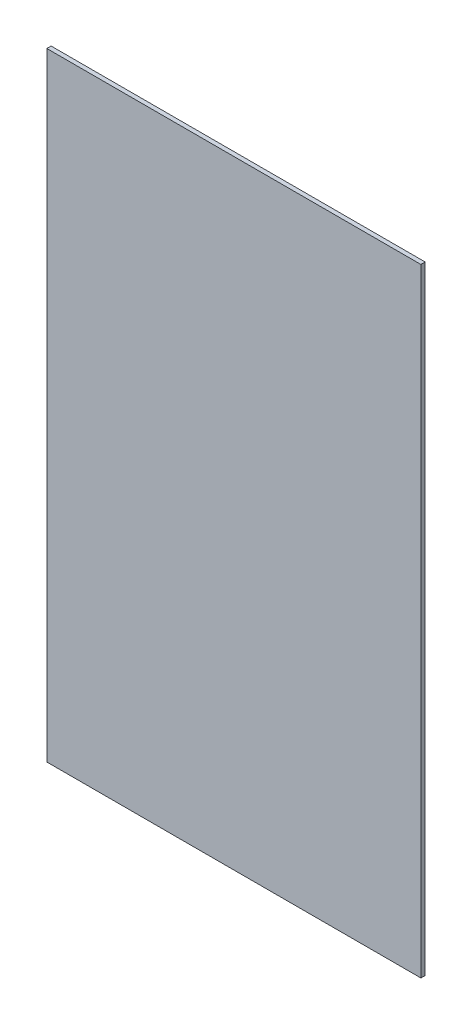
from build123d import *

# Parameters (mm, degrees)
SKETCH_1_W      = 524
SKETCH_1_H      = 865.6
EXTRUDE_1_DEPTH = 6


with BuildPart() as part:
    # Эскиз1 → Бобышка-Вытянуть1 (new body)
    with BuildSketch(Plane.XY):
        with Locations((-90.794024078, 232.074672892)):
            Rectangle(SKETCH_1_W, SKETCH_1_H)
    extrude(amount=-EXTRUDE_1_DEPTH)


solid = part.part
